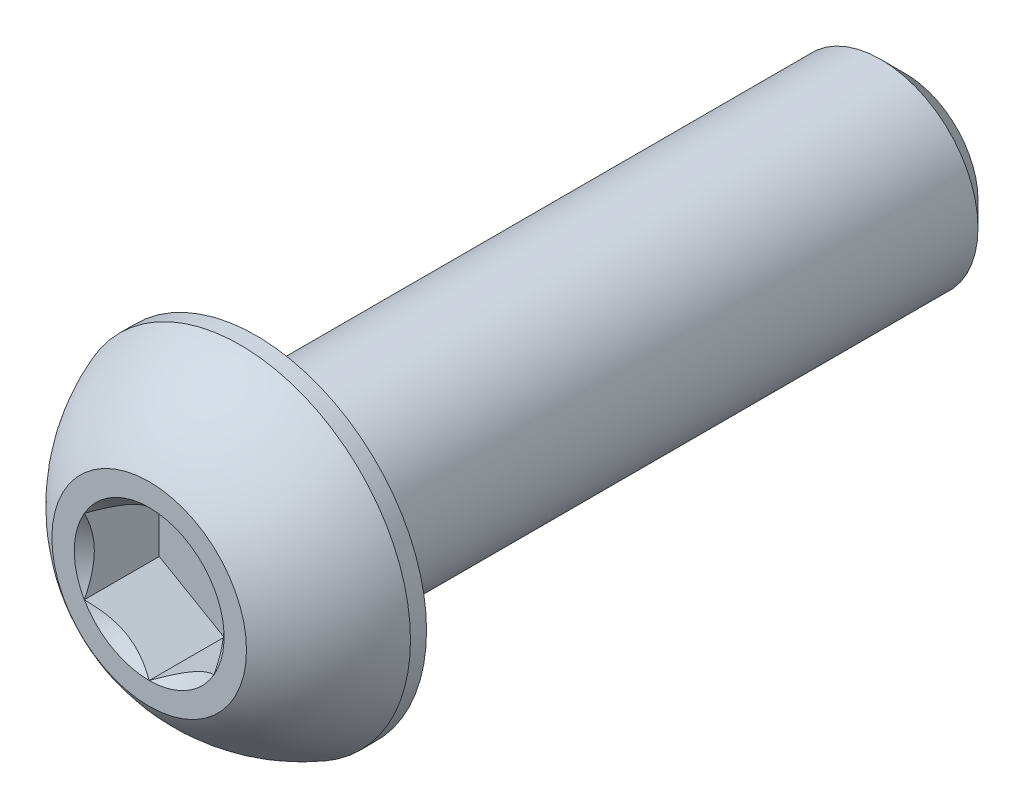
from build123d import *

# Parameters (mm, degrees)
CUT_EXTRUDE2_DEPTH = 2.31


with BuildPart() as part:
    # Sketch10 → Revolve3 (revolve)
    with BuildSketch(Plane(origin=(0, 0, 0), x_dir=(0, 0, -1), z_dir=(1, 0, 0)), mode=Mode.PRIVATE) as revolve3_sk:
        Polygon((22.55, 3), (23.3, 2.25), (23.3, 0), (3.3, 0), (3.3, 3), align=None)
    revolve(revolve3_sk.sketch.rotate(Axis((0, 0, 0), (0, 0, -1)), 90), axis=Axis((0, 0, 0), (0, 0, -1)))

    # Sketch7 → Revolve2 (revolve)
    with BuildSketch(Plane(origin=(0, 0, 0), x_dir=(0, 0, -1), z_dir=(1, 0, 0)), mode=Mode.PRIVATE) as revolve2_sk:
        with BuildLine():
            Line((2.805, 5.25), (3.3, 5.25))
            Line((3.3, 5.25), (3.3, 0))
            Line((3.3, 0), (0, 0))
            Line((0, 0), (0, 3))
            ThreePointArc((0, 3), (1.216479019, 4.356906156), (2.805, 5.25))
        make_face()
    revolve(revolve2_sk.sketch.rotate(Axis((0, 0, 0), (0, 0, -1)), 180), axis=Axis((0, 0, 0), (0, 0, -1)))

    # Sketch5 → Cut-Extrude2 (cut)
    with BuildSketch(Plane.XY):
        Polygon((2, -1.154700538), (2, 1.154700538), (0, 2.309401077), (-2, 1.154700538), (-2, -1.154700538), (0, -2.309401077), align=None)
    extrude(amount=-CUT_EXTRUDE2_DEPTH, mode=Mode.SUBTRACT)

    # Cut-Extrude3 cone 1 section (through the dimple's axis) → Cut-Extrude3 (revolve, cut)
    with BuildSketch(Plane(origin=(0, 0, 0), x_dir=(0, -1, 0), z_dir=(1, 0, 0))):
        Polygon((0, 0), (2.309401077, 0), (0, 2.309401077), align=None)
    revolve(axis=Axis((0, 0, 0), (0, 0, -1)), mode=Mode.SUBTRACT)


with BuildPart() as body_2:
    # Split1: read off the stored shape, not the designer's step
    # Split1: the piece on the far side of the plane
    add(part.part)
    split(bisect_by=Plane.XY.offset(-3.3), keep=Keep.BOTTOM)


with BuildPart() as part_1:
    add(part.part)

    # Split1
    split(bisect_by=Plane.XY.offset(-3.3), keep=Keep.TOP)


with BuildPart() as body_2_1:
    add(body_2.part)

    # Boss-Extrude1: read off the stored shape, not the designer's step
    # Boss-Extrude1: union part
    add(part_1.part)


solid = body_2_1.part
